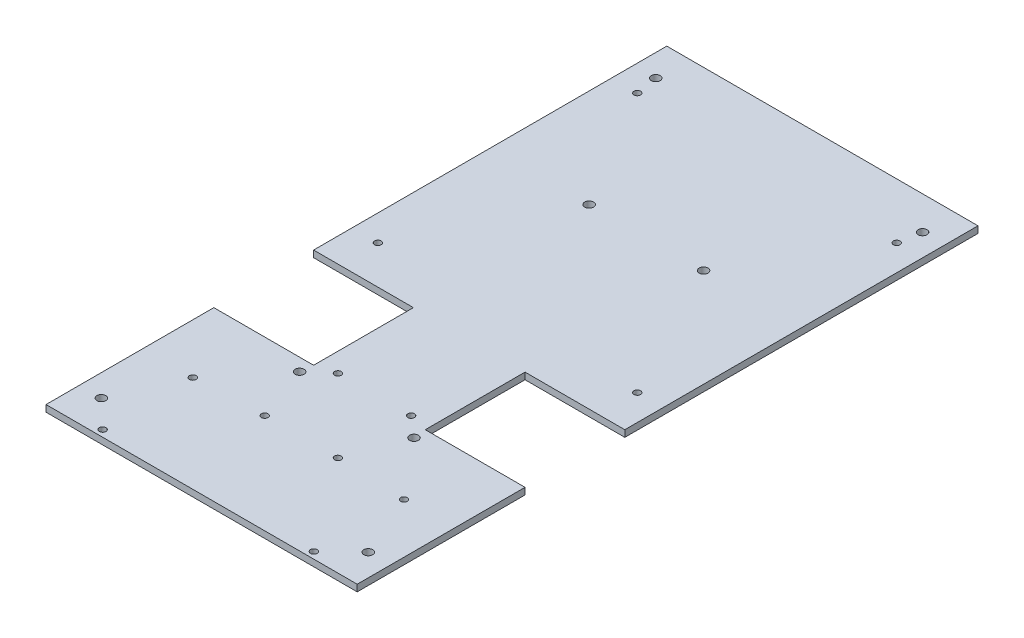
from build123d import *

# Parameters (mm, degrees)
SCHIZZO1_W                   = 140.36
SCHIZZO1_H                   = 280
ESTRUSIONE_ESTRUSIONE1_DEPTH = 3
SCHIZZO2_R                   = 2
TAGLIO_ESTRUSIONE1_DEPTH     = 194.899785911
SCHIZZO3_W                   = 45
SCHIZZO3_H                   = 45
TAGLIO_ESTRUSIONE2_DEPTH     = 194.899785911
SCHIZZO4_R                   = 1.5
SCHIZZO4_R_2                 = 2
TAGLIO_ESTRUSIONE3_DEPTH     = 194.899785911


with BuildPart() as part:
    # Schizzo1 → Estrusione-Estrusione1 (new body)
    with BuildSketch(Plane(origin=(0, 0, 0), x_dir=(1, 0, 0), z_dir=(0, 1, 0))):
        with Locations((-26.670393701, -27.952755906)):
            Rectangle(SCHIZZO1_W, SCHIZZO1_H)
    extrude(amount=ESTRUSIONE_ESTRUSIONE1_DEPTH)

    # Schizzo2 → Taglio-Estrusione1 (cut, through all)
    with BuildSketch(Plane(origin=(0, 3, 0), x_dir=(1, 0, 0), z_dir=(0, 1, 0))):
        with Locations((-86.850393701, -152.952755906)):
            Circle(SCHIZZO2_R)
        with Locations((33.509606299, -152.952755906)):
            Circle(SCHIZZO2_R)
        with Locations((-86.850393701, 97.047244094)):
            Circle(SCHIZZO2_R)
        with Locations((33.509606299, 97.047244094)):
            Circle(SCHIZZO2_R)
    extrude(amount=-TAGLIO_ESTRUSIONE1_DEPTH, mode=Mode.SUBTRACT)

    # Schizzo3 → Taglio-Estrusione2 (cut, through all)
    with BuildSketch(Plane(origin=(0, 0, 0), x_dir=(1, 0, 0), z_dir=(0, 1, 0))):
        with Locations((-74.350393701, -69.752755906)):
            Rectangle(SCHIZZO3_W, SCHIZZO3_H)
        with Locations((21.009606299, -69.752755906)):
            Rectangle(SCHIZZO3_W, SCHIZZO3_H)
    extrude(amount=TAGLIO_ESTRUSIONE2_DEPTH, mode=Mode.SUBTRACT)

    # Schizzo4 → Taglio-Estrusione3 (cut, through all)
    with BuildSketch(Plane(origin=(0, 0, 0), x_dir=(1, 0, 0), z_dir=(0, 1, 0))):
        with Locations((-85.170393701, 87.047244094)):
            Circle(SCHIZZO4_R)
        with Locations((-85.170393701, -29.952755906)):
            Circle(SCHIZZO4_R)
        with Locations((31.829606299, -29.952755906)):
            Circle(SCHIZZO4_R)
        with Locations((31.829606299, 87.047244094)):
            Circle(SCHIZZO4_R)
        with Locations((-43.180393701, -89.952755906)):
            Circle(SCHIZZO4_R)
        with Locations((-10.160393701, -89.952755906)):
            Circle(SCHIZZO4_R)
        with Locations((-10.160393701, -122.972755906)):
            Circle(SCHIZZO4_R)
        with Locations((-43.180393701, -122.972755906)):
            Circle(SCHIZZO4_R)
        with Locations((-52.470393701, -97.952755906)):
            Circle(SCHIZZO4_R_2)
        with Locations((-0.870393701, -97.952755906)):
            Circle(SCHIZZO4_R_2)
        with Locations((-0.870393701, 32.647244094)):
            Circle(SCHIZZO4_R_2)
        with Locations((-52.470393701, 32.647244094)):
            Circle(SCHIZZO4_R_2)
        with Locations((-74.295393701, -124.312755906)):
            Circle(SCHIZZO4_R)
        with Locations((20.954606299, -124.312755906)):
            Circle(SCHIZZO4_R)
        with Locations((20.954606299, -164.952755906)):
            Circle(SCHIZZO4_R)
        with Locations((-74.295393701, -164.952755906)):
            Circle(SCHIZZO4_R)
    extrude(amount=TAGLIO_ESTRUSIONE3_DEPTH, mode=Mode.SUBTRACT)


solid = part.part
